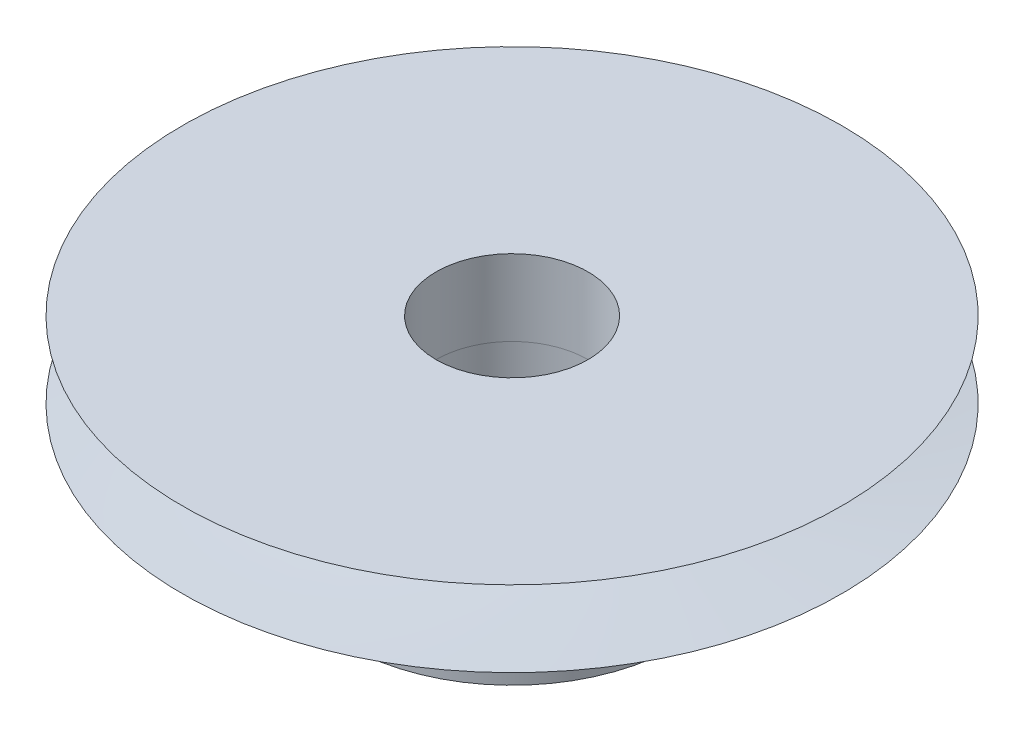
from build123d import *

# Parameters (mm, degrees)
SKETCH117_R           = 3
CUT_EXTRUDE4_DEPTH    = 3
SKETCH122_R           = 6.539767279
BOSS_EXTRUDE1_DEPTH   = 5
SKETCH123_R           = 3.0360463
CUT_EXTRUDE5_DEPTH    = 5
M2X0_4_TAPPED_HOLE1_D = 1.6


with BuildPart() as part:
    # Sketch9 → Revolve1 (revolve)
    with BuildSketch(Plane.XY):
        with BuildLine():
            Line((-4.703089141, -2.935363462), (8.296910859, -2.935363462))
            Line((8.296910859, -2.935363462), (8.296910859, 0.064636538))
            Line((8.296910859, 0.064636538), (-4.703089141, 0.064636538))
            add(Edge.make_bspline(
                [(-4.703089141, 0.064636538), (8.296910859, -1.435363462), (-4.703089141, -2.935363462)],
                knots=[0, 0, 0, 1, 1, 1], degree=2))
        make_face()
    revolve(axis=Axis((8.296910859, -2.935363462, 0), (0, 1, 0)))

    # Sketch117 → Cut-Extrude4 (cut)
    with BuildSketch(Plane(origin=(0, 0.064636538, 0), x_dir=(1, 0, 0), z_dir=(0, 1, 0))):
        with Locations((8.29691086, 0)):
            Circle(SKETCH117_R)
    extrude(amount=-CUT_EXTRUDE4_DEPTH, mode=Mode.SUBTRACT)

    # Sketch122 → Boss-Extrude1 (add)
    with BuildSketch(Plane(origin=(0, -2.935363462, 0), x_dir=(-1, 0, 0), z_dir=(0, -1, 0))):
        with Locations((-8.29691086, 0)):
            Circle(SKETCH122_R)
    extrude(amount=BOSS_EXTRUDE1_DEPTH)

    # Sketch123 → Cut-Extrude5 (cut)
    with BuildSketch(Plane(origin=(0, -2.935363462, 0), x_dir=(1, 0, 0), z_dir=(0, 1, 0))):
        with Locations((8.33295716, 0)):
            Circle(SKETCH123_R)
    extrude(amount=-CUT_EXTRUDE5_DEPTH, mode=Mode.SUBTRACT)

    # M2x0.4 Tapped Hole1 (through all)
    with Locations(Plane(origin=(1.815385484, -5.431649491, -0.870852953), x_dir=(0.133162682309, 0, -0.991094193324), z_dir=(-0.991094193324, 0, -0.133162682309))):
        with Locations((0, 0)):
            Hole(M2X0_4_TAPPED_HOLE1_D / 2)


solid = part.part
